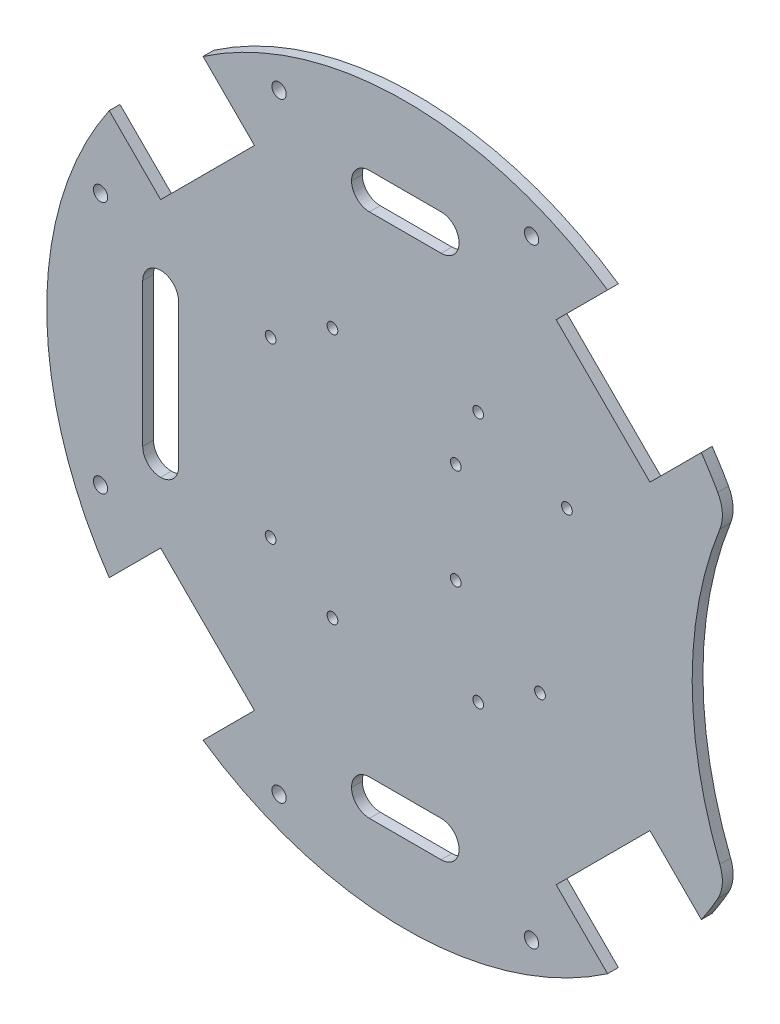
from build123d import *

# Parameters (mm, degrees)
CROQUIS1_R              = 100
SALIENTE_EXTRUIR1_DEPTH = 3
CROQUIS3_R              = 110
CORTAR_EXTRUIR1_DEPTH   = 3
REDONDEO1_R             = 10
CORTAR_EXTRUIR2_DEPTH   = 142.453172607
CROQUIS6_W              = 10
CROQUIS6_H              = 50
CROQUIS6_W_2            = 30
CROQUIS6_H_2            = 10
CORTAR_EXTRUIR4_DEPTH   = 10
REDONDEO3_R             = 5
CROQUIS7_R              = 1.5
CORTAR_EXTRUIR5_DEPTH   = 142.453172607
CROQUIS8_R              = 1.5
CORTAR_EXTRUIR6_DEPTH   = 142.453172607
CROQUIS9_R              = 2
CORTAR_EXTRUIR7_DEPTH   = 142.453172607


with BuildPart() as part:
    # Croquis1 → Saliente-Extruir1 (new body)
    with BuildSketch(Plane.XY):
        Circle(CROQUIS1_R)
    extrude(amount=SALIENTE_EXTRUIR1_DEPTH)

    # Croquis3 → Cortar-Extruir1 (cut)
    with BuildSketch(Plane.XY.offset(3)):
        with Locations((190, 0)):
            Circle(CROQUIS3_R)
    extrude(amount=-CORTAR_EXTRUIR1_DEPTH, mode=Mode.SUBTRACT)

    # Redondeo1
    redondeo1_edges = [part.edges().sort_by_distance(p)[0] for p in [
        (89.473684211, -44.659375654, 1.5),
        (89.473684211, 44.659375654, 1.5),
    ]]
    fillet(redondeo1_edges, radius=REDONDEO1_R)

    # Croquis4 → Cortar-Extruir2 (cut, through all)
    with BuildSketch(Plane.XY.offset(3)):
        Polygon((-57.629202667, -83.792153571), (-83.792153571, -57.629202667), (-68.235804385, -42.072853481), (-42.072853481, -68.235804385), align=None)
        Polygon((-57.629202667, 83.792153571), (-42.072853481, 68.235804385), (-68.235804385, 42.072853481), (-83.792153571, 57.629202667), align=None)
        Polygon((83.792153571, 57.629202667), (68.235804385, 42.072853481), (42.072853481, 68.235804385), (57.629202667, 83.792153571), align=None)
        Polygon((57.629202667, -83.792153571), (42.072853481, -68.235804385), (68.235804385, -42.072853481), (83.792153571, -57.629202667), align=None)
    extrude(amount=-CORTAR_EXTRUIR2_DEPTH, mode=Mode.SUBTRACT)

    # Croquis6 → Cortar-Extruir4 (cut)
    with BuildSketch(Plane.XY.offset(3)):
        with Locations((-68.235804385, 0)):
            Rectangle(CROQUIS6_W, CROQUIS6_H)
        with Locations((0, 73.24)):
            Rectangle(CROQUIS6_W_2, CROQUIS6_H_2)
        with Locations((0, -73.24)):
            Rectangle(CROQUIS6_W_2, CROQUIS6_H_2)
    extrude(amount=-CORTAR_EXTRUIR4_DEPTH, mode=Mode.SUBTRACT)

    # Redondeo3
    redondeo3_edges = [part.edges().sort_by_distance(p)[0] for p in [
        (15, -78.24, 1.5),
        (-15, -78.24, 1.5),
        (15, -68.24, 1.5),
        (-15, -68.24, 1.5),
        (-73.235804385, -25, 1.5),
        (-63.235804385, -25, 1.5),
        (-73.235804385, 25, 1.5),
        (-63.235804385, 25, 1.5),
        (-15, 68.24, 1.5),
        (15, 68.24, 1.5),
        (-15, 78.24, 1.5),
        (15, 78.24, 1.5),
    ]]
    fillet(redondeo3_edges, radius=REDONDEO3_R - 0.0001)  # a hair under: the kernel refuses the full size

    # Croquis7 → Cortar-Extruir5 (cut, through all)
    with BuildSketch(Plane(origin=(0, 0, 0), x_dir=(-1, 0, 0), z_dir=(0, 0, -1))):
        with Locations((37.565, -24.17)):
            Circle(CROQUIS7_R)
        with Locations((-37.565, -24.17)):
            Circle(CROQUIS7_R)
        with Locations((-45.065, 24.17)):
            Circle(CROQUIS7_R)
        with Locations((37.565, 24.17)):
            Circle(CROQUIS7_R)
        with Locations((-14.06559482, 19.297497716)):
            Circle(CROQUIS7_R)
        with Locations((-14.061195262, -8.714642909)):
            Circle(CROQUIS7_R)
    extrude(amount=-CORTAR_EXTRUIR5_DEPTH, mode=Mode.SUBTRACT)

    # Croquis8 → Cortar-Extruir6 (cut, through all)
    with BuildSketch(Plane(origin=(0, 0, 0), x_dir=(-1, 0, 0), z_dir=(0, 0, -1))):
        with Locations((-20.32, 35)):
            Circle(CROQUIS8_R)
        with Locations((20.32, 35)):
            Circle(CROQUIS8_R)
        with Locations(Location((20.32, -35, 0), (0, 0, 180))):
            Circle(CROQUIS8_R)
        with Locations(Location((-20.32, -35, 0), (0, 0, 180))):
            Circle(CROQUIS8_R)
    extrude(amount=-CORTAR_EXTRUIR6_DEPTH, mode=Mode.SUBTRACT)

    # Croquis9 → Cortar-Extruir7 (cut, through all)
    with BuildSketch(Plane(origin=(0, 0, 0), x_dir=(-1, 0, 0), z_dir=(0, 0, -1))):
        with Locations((-35.206875778, 84.996916991)):
            Circle(CROQUIS9_R)
        with Locations((35.206875778, 84.996916991)):
            Circle(CROQUIS9_R)
        with Locations((84.996916991, 35.206875778)):
            Circle(CROQUIS9_R)
        with Locations((84.996916991, -35.206875778)):
            Circle(CROQUIS9_R)
        with Locations((35.206875778, -84.996916991)):
            Circle(CROQUIS9_R)
        with Locations((-35.206875778, -84.996916991)):
            Circle(CROQUIS9_R)
    extrude(amount=-CORTAR_EXTRUIR7_DEPTH, mode=Mode.SUBTRACT)


solid = part.part
